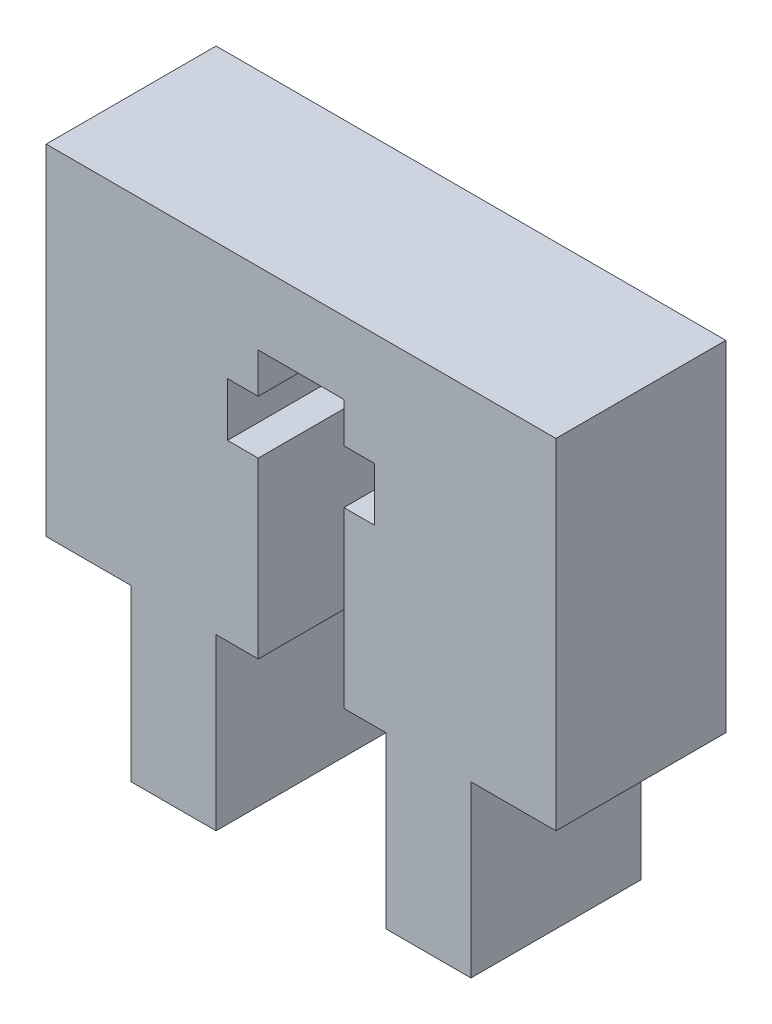
from build123d import *

# Parameters (mm, degrees)
BOSS_EXTRUDE1_DEPTH = 6.35
CUT_EXTRUDE3_DEPTH  = 22.298547486


with BuildPart() as part:
    # Sketch1 → Boss-Extrude1 (new body)
    with BuildSketch(Plane.XY):
        Polygon((-3.175, 12.7), (15.875, 12.7), (15.875, 0), (12.7, 0), (12.7, -6.35), (9.525, -6.35), (9.525, 0), (3.175, 0), (3.175, -6.35), (0, -6.35), (0, 0), (-3.175, 0), align=None)
    extrude(amount=BOSS_EXTRUDE1_DEPTH)

    # Sketch3 → Cut-Extrude3 (cut, through all)
    with BuildSketch(Plane.XY.offset(6.35)):
        Polygon((4.75, 0), (7.95, 0), (7.95, 6.5), (9.1, 6.5), (9.1, 8.5), (7.95, 8.5), (7.95, 10), (4.75, 10), (4.75, 8.5), (3.6, 8.5), (3.6, 6.5), (4.75, 6.5), align=None)
    extrude(amount=-CUT_EXTRUDE3_DEPTH, mode=Mode.SUBTRACT)


solid = part.part
